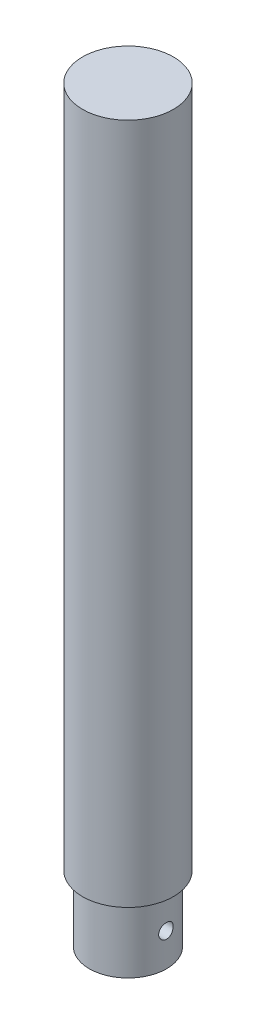
from build123d import *

# Parameters (mm, degrees)
SKETCH1_R               = 10
BOSS_EXTRUDE1_DEPTH     = 150
SKETCH2_R               = 8.5
SKETCH2_R_2             = 4.5
BOSS_EXTRUDE2_DEPTH     = 14.5
CUT_EXTRUDE1_DEPTH      = 14.5
CUT_EXTRUDE1_DEPTH_BACK = 14.5
SKETCH3_R               = 1.6


with BuildPart() as part:
    # Sketch1 → Boss-Extrude1 (new body)
    with BuildSketch(Plane(origin=(0, 0, 0), x_dir=(1, 0, 0), z_dir=(0, 1, 0))):
        Circle(SKETCH1_R)
    extrude(amount=BOSS_EXTRUDE1_DEPTH)

    # Sketch2 → Boss-Extrude2 (add)
    with BuildSketch(Plane.XZ):
        Circle(SKETCH2_R)
        Circle(SKETCH2_R_2, mode=Mode.SUBTRACT)
    extrude(amount=BOSS_EXTRUDE2_DEPTH)

    # Sketch3 → Cut-Extrude1 (cut, two sides: drawn at the far end of the back side and taken through both)
    with BuildSketch(Plane(origin=(0, 0, 0), x_dir=(0, 0, -1), z_dir=(1, 0, 0)).offset(-CUT_EXTRUDE1_DEPTH_BACK)):
        with Locations((0, -7.25)):
            Circle(SKETCH3_R)
    extrude(amount=CUT_EXTRUDE1_DEPTH + CUT_EXTRUDE1_DEPTH_BACK, mode=Mode.SUBTRACT)


solid = part.part
